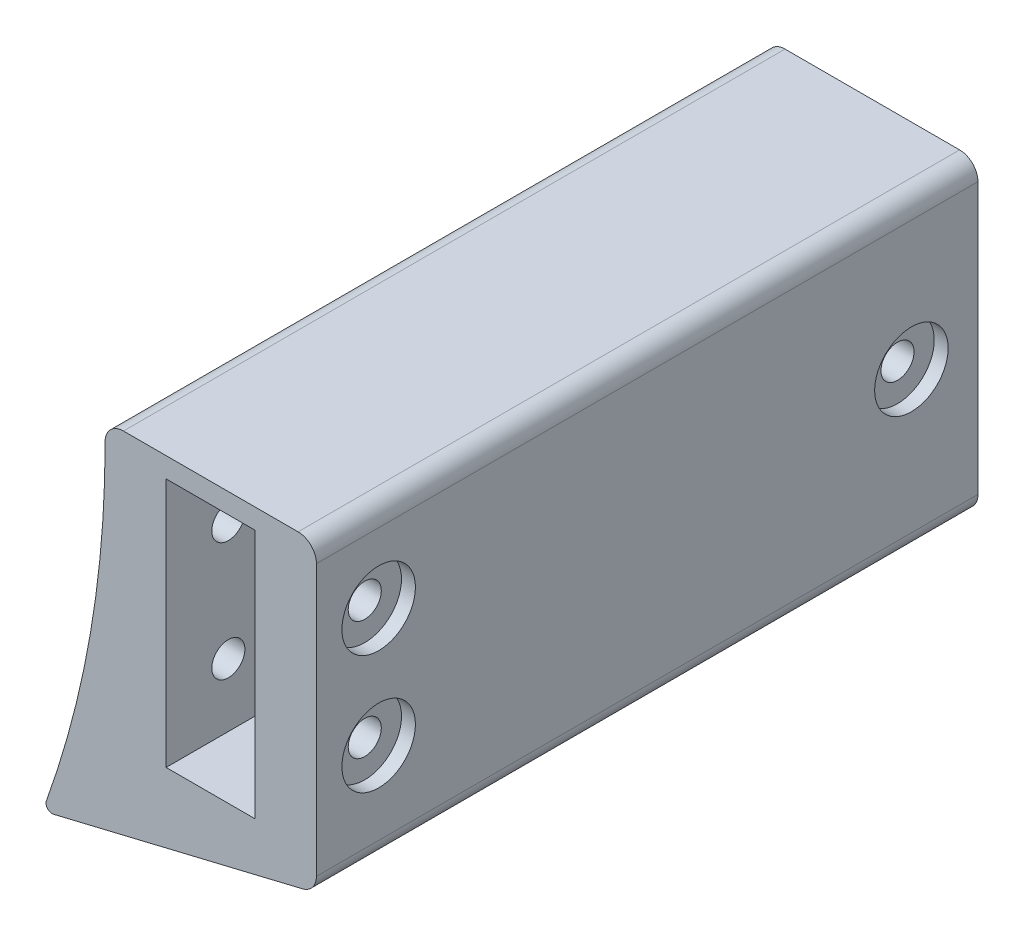
from build123d import *

# Parameters (mm, degrees)
ESQUISSE1_W                 = 14.54
ESQUISSE1_H                 = 40.8
BOSS_EXTRU_1_DEPTH          = 108
ESQUISSE5_W                 = 2.7
ESQUISSE5_H                 = 50
D_GAGEMENT_M1_62_AT_2_COUNT = 2
D_GAGEMENT_M1_62_AT_2_PITCH = 87.511022177
D_GAGEMENT_M1_62_AT_3_COUNT = 2
D_GAGEMENT_M1_62_AT_3_PITCH = 87.511022177
D_GAGEMENT_M1_63_D          = 5.4
D_GAGEMENT_M1_63_DEPTH      = 50
CONG_1_R                    = 3
CONG_2_R                    = 1
ESQUISSE6_R                 = 6
ENL_V_MAT_EXTRU_1_DEPTH     = 15


with BuildPart() as part:
    # Esquisse1 → Boss.-Extru.1 (new body)
    with BuildSketch(Plane.XY):
        with BuildLine():
            Line((-17.27, 44.084778495), (17.27, 44.084778495))
            Line((17.27, 44.084778495), (17.27, -5.485045193))
            Line((17.27, -5.485045193), (-27.460015919, -16.245802647))
            ThreePointArc((-27.460015919, -16.245802647), (-19.521650941, 13.439236404), (-17.27, 44.084778495))
        make_face()
        with Locations((0, 20.4)):
            Rectangle(ESQUISSE1_W, ESQUISSE1_H, mode=Mode.SUBTRACT)
    extrude(amount=BOSS_EXTRU_1_DEPTH)

    # Esquisse5 → Dégagement M1.62 (revolve, cut)
    with BuildSketch(Plane(origin=(-17.27, 20, 10.872493666), x_dir=(0, 0, 1), z_dir=(0, 1, 0))):
        with Locations((1.35, 25)):
            Rectangle(ESQUISSE5_W, ESQUISSE5_H)
    d_gagement_m1_62 = revolve(axis=Axis((-23.62, 20, 10.872493666), (1, 0, 0)), mode=Mode.SUBTRACT)

    # Dégagement M1.62 at 2: Dégagement M1.62 ×2
    with Locations(*[Vector(0, 0.11084801370756985, 0.9938373699238153) * (i * D_GAGEMENT_M1_62_AT_2_PITCH) for i in range(1, D_GAGEMENT_M1_62_AT_2_COUNT)]):
        add(d_gagement_m1_62, mode=Mode.SUBTRACT)

    # Dégagement M1.62 at 3: Dégagement M1.62 ×2
    with Locations(*[Vector(0, -0.11084801370756979, 0.9938373699238153) * (i * D_GAGEMENT_M1_62_AT_3_PITCH) for i in range(1, D_GAGEMENT_M1_62_AT_3_COUNT)]):
        add(d_gagement_m1_62, mode=Mode.SUBTRACT)

    # Dégagement M1.63
    with Locations(Plane(origin=(17.27, 0, 0), x_dir=(0, 0, -1), z_dir=(1, 0, 0))):
        with Locations((-97.844217786, 29.700422986), (-97.844217786, 10.299577014), (-10.872493666, 20)):
            Hole(D_GAGEMENT_M1_63_D / 2, depth=D_GAGEMENT_M1_63_DEPTH)

    # Congé1
    cong_1_edges = [part.edges().sort_by_distance(p)[0] for p in [
        (17.27, -5.485045193, 54),
        (-17.27, 44.084778495, 54),
        (17.27, 44.084778495, 54),
    ]]
    fillet(cong_1_edges, radius=CONG_1_R)

    # Congé2
    cong_2_edges = [part.edges().sort_by_distance(p)[0] for p in [
        (-27.460015919, -16.245802647, 54),
    ]]
    fillet(cong_2_edges, radius=CONG_2_R)

    # Esquisse6 → Enlèv. mat.-Extru.1 (cut)
    with BuildSketch(Plane(origin=(30, 0, 0), x_dir=(0, 0, -1), z_dir=(1, 0, 0))):
        with Locations((-10.872493666, 20)):
            Circle(ESQUISSE6_R)
        with Locations((-97.844217786, 29.700422986)):
            Circle(ESQUISSE6_R)
        with Locations((-97.844217786, 10.299577014)):
            Circle(ESQUISSE6_R)
    extrude(amount=-ENL_V_MAT_EXTRU_1_DEPTH, mode=Mode.SUBTRACT)


solid = part.part
